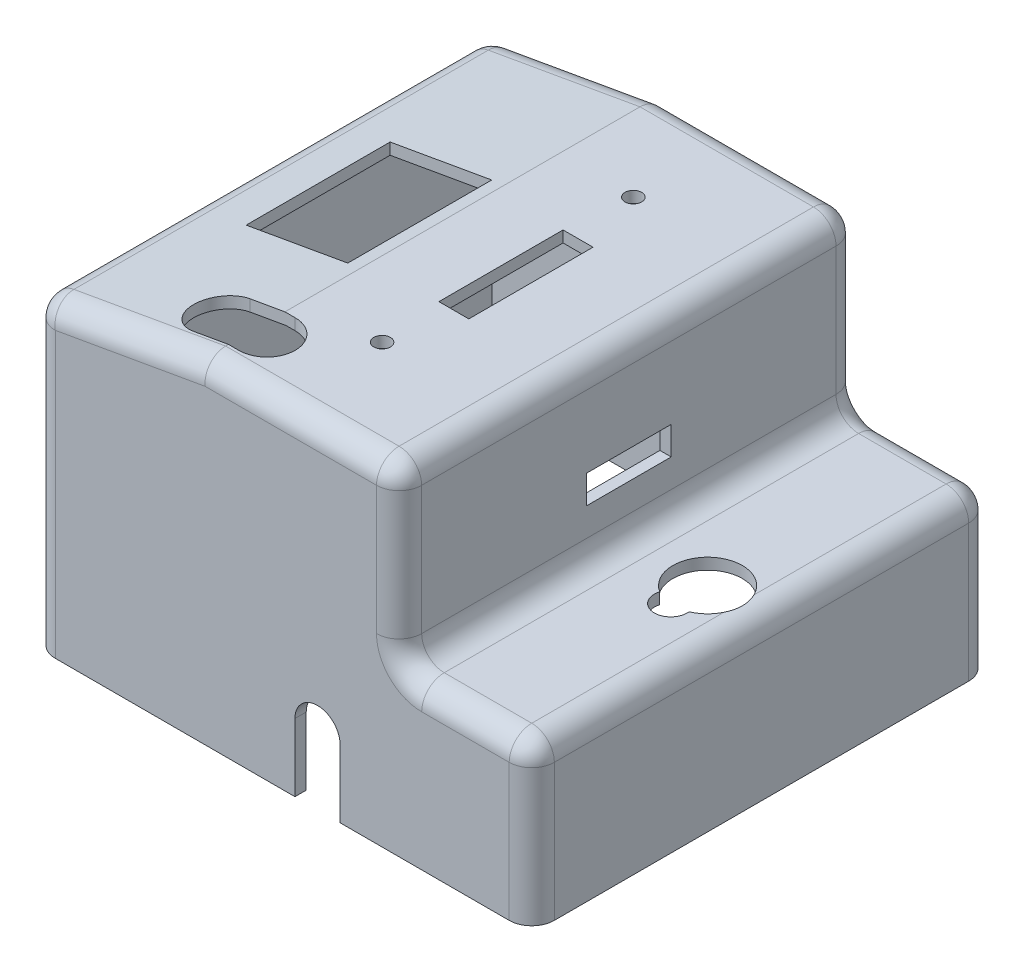
from build123d import *

# Parameters (mm, degrees)
BOSS_EXTRUDE1_DEPTH      = 38.7
BOSS_EXTRUDE1_DEPTH_BACK = 38.7
CHAMFER1_SIZE            = 5
CHAMFER1_SIZE2           = 28.356409098
SHELL1_T                 = 2
FILLET2_R                = 4
BOSS_EXTRUDE2_START      = -1.5
SKETCH2_W                = 6
SKETCH2_H                = 2.5
SKETCH2_H_2              = 6
SKETCH2_R                = 1.45
BOSS_EXTRUDE2_DEPTH      = 4
FILLET3_R                = 2
CUT_EXTRUDE1_REACH       = 69.496
SKETCH3_R                = 6.15
SKETCH3_R_2              = 2.9
BOSS_EXTRUDE3_START      = -1.5
SKETCH4_W                = 5
SKETCH4_H                = 20
BOSS_EXTRUDE3_DEPTH      = 2
FILLET4_R                = 2
CUT_EXTRUDE2_REACH       = 98.693
SKETCH5_W                = 15
SKETCH5_H                = 5
CUT_EXTRUDE3_DEPTH       = 110.820763104
CUT_EXTRUDE4_REACH       = 97
SKETCH7_W                = 18
SKETCH7_H                = 25.5
CUT_EXTRUDE5_REACH       = 86.209
CUT_EXTRUDE6_REACH       = 111.821
SKETCH10_W               = 13
SKETCH10_H               = 8
FILLET5_R                = 2
SKETCH11_W               = 5.3
SKETCH11_H               = 22
CUT_EXTRUDE7_DEPTH       = 85.208847569
SKETCH12_R               = 1.475
CUT_EXTRUDE8_DEPTH       = 85.208847569


with BuildPart() as part:
    # Sketch1 → Boss-Extrude1 (new, two sides: drawn at the far end of the back side and taken through both)
    with BuildSketch(Plane.XY.offset(-BOSS_EXTRUDE1_DEPTH_BACK)):
        Polygon((-42.2, 0), (42.2, 0), (42.2, 26.25), (18.7, 26.25), (18.7, 57), (-42.2, 57), align=None)
    extrude(amount=BOSS_EXTRUDE1_DEPTH + BOSS_EXTRUDE1_DEPTH_BACK)

    # Chamfer1
    chamfer1_edges = [part.edges().sort_by_distance(p)[0] for p in [
        (-42.2, 57, 0),
    ]]
    chamfer1_side = [part.faces().sort_by_distance(p)[0] for p in [
        (-42.2, 28.5, 0),
    ]]
    chamfer(chamfer1_edges, length=CHAMFER1_SIZE, length2=CHAMFER1_SIZE2, reference=chamfer1_side[0])

    # Shell1
    shell1_openings = [part.faces().sort_by_distance(p)[0] for p in [
        (0, 0, 0),
    ]]
    offset(amount=SHELL1_T, openings=shell1_openings, kind=Kind.INTERSECTION)

    # Fillet2
    # the kernel refuses this fillet: 4 mm, written as the material it adds along each edge
    with BuildSketch(Plane(origin=(20.7, 28.25, -40.7), x_dir=(0, 1, 0), z_dir=(0, 0, 1))) as fillet2_piece_1:
        with BuildLine():
            CenterArc((FILLET2_R, -FILLET2_R), FILLET2_R, 90, 90)
            Line((0, -FILLET2_R), (0, 0))
            Line((0, 0), (FILLET2_R, 0))
        make_face()
    extrude(amount=81.4)
    # the kernel refuses this fillet: 4 mm, written as the material it takes off along each edge
    with BuildSketch(Plane(origin=(-40.2, 50.321800738, 36.7), x_dir=(-0.1736481776669273, 0.9848077530122087, 0), z_dir=(0, 0, 1))) as fillet2_2_piece_1_section:
        Polygon((0, 0), (FILLET2_R, 0), (FILLET2_R, FILLET2_R * 0.839099631177), (FILLET2_R * 0.173648177667, FILLET2_R * 0.984807753012), align=None)
    fillet2_2_piece_1 = extrude(amount=FILLET2_R, mode=Mode.PRIVATE)
    fillet2_2_piece_1 = fillet2_2_piece_1 - Plane(origin=(-40.2, 50.321800738, 36.7), x_dir=(0.766044443118977, -0.6427876096865405, 0), z_dir=(0, 0, 1)) * Sphere(FILLET2_R, mode=Mode.PRIVATE)
    add(fillet2_2_piece_1, mode=Mode.SUBTRACT)
    with BuildSketch(Plane(origin=(-40.2, 50.321800738, -36.7), x_dir=(-0.1736481776669273, 0.9848077530122087, 0), z_dir=(0, 0, -1))) as fillet2_2_piece_2_section:
        Polygon((0, 0), (FILLET2_R, 0), (FILLET2_R, -FILLET2_R * 0.839099631177), (FILLET2_R * 0.173648177667, -FILLET2_R * 0.984807753012), align=None)
    fillet2_2_piece_2 = extrude(amount=FILLET2_R, mode=Mode.PRIVATE)
    fillet2_2_piece_2 = fillet2_2_piece_2 - Plane(origin=(-40.2, 50.321800738, -36.7), x_dir=(0.766044443118977, -0.6427876096865405, 0), z_dir=(0, 0, -1)) * Sphere(FILLET2_R, mode=Mode.PRIVATE)
    add(fillet2_2_piece_2, mode=Mode.SUBTRACT)
    with BuildSketch(Plane(origin=(20.7, 59, 50.7), x_dir=(0, -1, 0), z_dir=(0, 0, -1)), Plane(origin=(44.2, 28.25, 50.7), x_dir=(0, -1, 0), z_dir=(0, 0, -1))) as fillet2_2_piece_3:
        with BuildLine():
            CenterArc((FILLET2_R, FILLET2_R), FILLET2_R, 180, 90)
            Line((0, FILLET2_R), (0, 0))
            Line((0, 0), (FILLET2_R, 0))
        make_face()
    extrude(amount=101.4, mode=Mode.SUBTRACT)
    with BuildSketch(Plane(origin=(44.2, 38.25, -40.7), x_dir=(0, 0, 1), z_dir=(0, -1, 0))) as fillet2_2_piece_4:
        with BuildLine():
            CenterArc((FILLET2_R, FILLET2_R), FILLET2_R, 180, 90)
            Line((0, FILLET2_R), (0, 0))
            Line((0, 0), (FILLET2_R, 0))
        make_face()
    extrude(amount=48.25, mode=Mode.SUBTRACT)
    with BuildSketch(Plane(origin=(44.2, -10, 40.7), x_dir=(-1, 0, 0), z_dir=(0, 1, 0))) as fillet2_2_piece_5:
        with BuildLine():
            CenterArc((FILLET2_R, -FILLET2_R), FILLET2_R, 90, 90)
            Line((0, -FILLET2_R), (0, 0))
            Line((0, 0), (FILLET2_R, 0))
        make_face()
    extrude(amount=48.25, mode=Mode.SUBTRACT)
    with BuildSketch(Plane(origin=(30.7, 59, 40.7), x_dir=(0, -1, 0), z_dir=(-1, 0, 0)), Plane(origin=(-24.018568229, 59, -40.7), x_dir=(0, -1, 0), z_dir=(1, 0, 0))) as fillet2_2_piece_6:
        with BuildLine():
            CenterArc((FILLET2_R, -FILLET2_R), FILLET2_R, 90, 90)
            Line((0, -FILLET2_R), (0, 0))
            Line((0, 0), (FILLET2_R, 0))
        make_face()
    extrude(amount=54.718568229, mode=Mode.SUBTRACT)
    with BuildSketch(Plane(origin=(-44.2, 50.321800738, 40.7), x_dir=(0, 0, -1), z_dir=(0, -1, 0)), Plane(origin=(-44.2, -10, -40.7), x_dir=(0, 0, 1), z_dir=(0, 1, 0))) as fillet2_2_piece_7:
        with BuildLine():
            CenterArc((FILLET2_R, FILLET2_R), FILLET2_R, 180, 90)
            Line((0, FILLET2_R), (0, 0))
            Line((0, 0), (FILLET2_R, 0))
        make_face()
    extrude(amount=60.321800738, mode=Mode.SUBTRACT)
    with BuildSketch(Plane(origin=(-4.170490699, 60.736481777, 40.7), x_dir=(0.17364817766692728, -0.9848077530122086, 0), z_dir=(-0.9848077530122087, -0.1736481776669273, 0)), Plane(origin=(-40.894592711, 54.26103175, -40.7), x_dir=(0.1736481776669273, -0.9848077530122087, 1.77635683940025e-15), z_dir=(0.9848077530122087, 0.1736481776669273, 0))) as fillet2_2_piece_8:
        with BuildLine():
            CenterArc((FILLET2_R, -FILLET2_R), FILLET2_R, 90, 90)
            Line((0, -FILLET2_R), (0, 0))
            Line((0, 0), (FILLET2_R, 0))
        make_face()
    extrude(amount=37.29063048, mode=Mode.SUBTRACT)
    with BuildSketch(Plane(origin=(-44.2, 53.678199262, -36.7), x_dir=(0, -1, 0), z_dir=(0, 0, 1))) as fillet2_2_piece_9:
        with BuildLine():
            CenterArc((FILLET2_R * 0.839099631177, FILLET2_R), FILLET2_R, 190, 80)
            Line((-FILLET2_R * 0.145708121835, FILLET2_R * 0.826351822333), (0, 0))
            Line((0, 0), (FILLET2_R * 0.839099631177, 0))
        make_face()
    extrude(amount=73.4, mode=Mode.SUBTRACT)
    # the kernel refuses this fillet: 4 mm, written as the material it takes off along each edge
    with BuildSketch(Plane(origin=(16.7, 55, -36.7), x_dir=(1, 0, 0), z_dir=(0, 0, -1))) as fillet2_3_piece_1_section:
        Polygon((0, 0), (FILLET2_R, 0), (FILLET2_R, -FILLET2_R), (0, -FILLET2_R), align=None)
    fillet2_3_piece_1 = extrude(amount=FILLET2_R, mode=Mode.PRIVATE)
    fillet2_3_piece_1 = fillet2_3_piece_1 - Plane(origin=(16.7, 55, -36.7), x_dir=(-0.7071067811865475, -0.7071067811865476, 0), z_dir=(0, 0, -1)) * Sphere(FILLET2_R, mode=Mode.PRIVATE)
    add(fillet2_3_piece_1, mode=Mode.SUBTRACT)
    with BuildSketch(Plane(origin=(16.7, 55, 36.7), x_dir=(1, 0, 0), z_dir=(0, 0, 1))) as fillet2_3_piece_2_section:
        Polygon((0, 0), (FILLET2_R, 0), (FILLET2_R, FILLET2_R), (0, FILLET2_R), align=None)
    fillet2_3_piece_2 = extrude(amount=FILLET2_R, mode=Mode.PRIVATE)
    fillet2_3_piece_2 = fillet2_3_piece_2 - Plane(origin=(16.7, 55, 36.7), x_dir=(-0.7071067811865475, -0.7071067811865476, 0), z_dir=(0, 0, 1)) * Sphere(FILLET2_R, mode=Mode.PRIVATE)
    add(fillet2_3_piece_2, mode=Mode.SUBTRACT)
    with BuildSketch(Plane(origin=(40.2, 24.25, 36.7), x_dir=(0, 1, 0), z_dir=(0, 0, 1))) as fillet2_3_piece_3_section:
        Polygon((0, 0), (FILLET2_R, 0), (FILLET2_R, -FILLET2_R), (0, -FILLET2_R), align=None)
    fillet2_3_piece_3 = extrude(amount=FILLET2_R, mode=Mode.PRIVATE)
    fillet2_3_piece_3 = fillet2_3_piece_3 - Plane(origin=(40.2, 24.25, 36.7), x_dir=(-0.7071067811865475, -0.7071067811865476, 0), z_dir=(0, 0, 1)) * Sphere(FILLET2_R, mode=Mode.PRIVATE)
    add(fillet2_3_piece_3, mode=Mode.SUBTRACT)
    with BuildSketch(Plane(origin=(40.2, 24.25, -36.7), x_dir=(0, 1, 0), z_dir=(0, 0, -1))) as fillet2_3_piece_4_section:
        Polygon((0, 0), (FILLET2_R, 0), (FILLET2_R, FILLET2_R), (0, FILLET2_R), align=None)
    fillet2_3_piece_4 = extrude(amount=FILLET2_R, mode=Mode.PRIVATE)
    fillet2_3_piece_4 = fillet2_3_piece_4 - Plane(origin=(40.2, 24.25, -36.7), x_dir=(-0.7071067811865475, -0.7071067811865476, 0), z_dir=(0, 0, -1)) * Sphere(FILLET2_R, mode=Mode.PRIVATE)
    add(fillet2_3_piece_4, mode=Mode.SUBTRACT)
    with BuildSketch(Plane(origin=(24.7, 28.25, -40.7), x_dir=(0, -1, 0), z_dir=(1, 0, 0)), Plane(origin=(40.2, 28.25, 40.7), x_dir=(0, -1, 0), z_dir=(-1, 0, 0))) as fillet2_3_piece_5:
        with BuildLine():
            CenterArc((FILLET2_R, -FILLET2_R), FILLET2_R, 90, 90)
            Line((0, -FILLET2_R), (0, 0))
            Line((0, 0), (FILLET2_R, 0))
        make_face()
    extrude(amount=15.5, mode=Mode.SUBTRACT)
    with BuildSketch(Plane(origin=(20.7, 32.25, 40.7), x_dir=(-1, 0, 0), z_dir=(0, 1, 0)), Plane(origin=(20.7, 55, -40.7), x_dir=(-1, 0, 0), z_dir=(0, -1, 0))) as fillet2_3_piece_6:
        with BuildLine():
            CenterArc((FILLET2_R, -FILLET2_R), FILLET2_R, 90, 90)
            Line((0, -FILLET2_R), (0, 0))
            Line((0, 0), (FILLET2_R, 0))
        make_face()
    extrude(amount=22.75, mode=Mode.SUBTRACT)
    with BuildSketch(Plane(origin=(24.7, 32.25, -40.7), x_dir=(-1, 0, 0), z_dir=(0, 1, 0))) as fillet2_3_piece_7:
        with BuildLine():
            CenterArc((4 + FILLET2_R, FILLET2_R), FILLET2_R, 180, 90)
            Line((4, FILLET2_R), (4, 0))
            Line((4, 0), (4 + FILLET2_R, 0))
        make_face()
    revolve(axis=Axis((24.7, 32.25, -40.7), (0, 0, 1)), revolution_arc=90, mode=Mode.SUBTRACT)
    with BuildSketch(Plane(origin=(24.7, 32.25, 40.7), x_dir=(-1, 0, 0), z_dir=(0, 1, 0))) as fillet2_3_piece_8:
        with BuildLine():
            CenterArc((4 + FILLET2_R, -FILLET2_R), FILLET2_R, 90, 90)
            Line((4, -FILLET2_R), (4, 0))
            Line((4, 0), (4 + FILLET2_R, 0))
        make_face()
    revolve(axis=Axis((24.7, 32.25, 40.7), (0, 0, 1)), revolution_arc=90, mode=Mode.SUBTRACT)

    # Sketch2 → Boss-Extrude2 (add)
    # profile 1 of 2: a face of its own
    with BuildSketch(Plane.XZ.offset(BOSS_EXTRUDE2_START)):
        with Locations((39.2, -37.45)):
            Rectangle(SKETCH2_W, SKETCH2_H)
    # profile 2 of 2: a face of its own
    with BuildSketch(Plane.XZ.offset(BOSS_EXTRUDE2_START)):
        with Locations((39.2, -33.2)):
            Rectangle(SKETCH2_W, SKETCH2_H_2)
        with Locations(Location((39.2, -33.2, 0), (0, 0, 270))):
            Circle(SKETCH2_R, mode=Mode.SUBTRACT)
    boss_extrude2 = extrude(amount=-BOSS_EXTRUDE2_DEPTH)

    # Mirror1: Boss-Extrude2 across plane
    add(boss_extrude2.mirror(Plane.XY))

    # Fillet3
    fillet3_edges = [part.edges().sort_by_distance(p)[0] for p in [
        (42.2, 3.5, -30.2),
        (36.2, 3.5, -38.7),
        (36.2, 3.5, -30.2),
        (42.2, 3.5, 30.2),
        (36.2, 3.5, 30.2),
        (36.2, 3.5, 38.7),
    ]]
    fillet(fillet3_edges, radius=FILLET3_R)

    # Sketch3 → Cut-Extrude1 (cut, up to next)
    with BuildSketch(Plane(origin=(0, 28.25, 0), x_dir=(1, 0, 0), z_dir=(0, 1, 0)), mode=Mode.PRIVATE) as cut_extrude1_sk1:
        with Locations((34.65, 0)):
            Circle(SKETCH3_R)
    cut_extrude1_tool1 = extrude(cut_extrude1_sk1.sketch, amount=-CUT_EXTRUDE1_REACH, mode=Mode.PRIVATE) & part.part
    # Sketch3 → Cut-Extrude1 (cut, up to next)
    with BuildSketch(Plane(origin=(0, 28.25, 0), x_dir=(1, 0, 0), z_dir=(0, 1, 0)), mode=Mode.PRIVATE) as cut_extrude1_sk2:
        with Locations((34.151698836, -6.029444083)):
            Circle(SKETCH3_R_2)
    cut_extrude1_tool2 = extrude(cut_extrude1_sk2.sketch, amount=-CUT_EXTRUDE1_REACH, mode=Mode.PRIVATE) & part.part
    add(cut_extrude1_tool1.solids().sort_by_distance((34.65, 28.25, 0))[0], mode=Mode.SUBTRACT)
    add(cut_extrude1_tool2.solids().sort_by_distance((34.151699, 28.25, 6.029444))[0], mode=Mode.SUBTRACT)

    # Sketch4 → Boss-Extrude3 (add)
    with BuildSketch(Plane.XZ.offset(BOSS_EXTRUDE3_START)):
        with Locations((-39.7, 0)):
            Rectangle(SKETCH4_W, SKETCH4_H)
    extrude(amount=-BOSS_EXTRUDE3_DEPTH)

    # Fillet4
    fillet4_edges = [part.edges().sort_by_distance(p)[0] for p in [
        (-42.2, 3.5, 0),
        (-42.2, 2.5, -10),
        (-42.2, 2.5, 10),
    ]]
    fillet(fillet4_edges, radius=FILLET4_R)

    # Sketch5 → Cut-Extrude2 (cut, up to next)
    with BuildSketch(Plane(origin=(20.7, 0, 0), x_dir=(0, 0, -1), z_dir=(1, 0, 0)), mode=Mode.PRIVATE) as cut_extrude2_sk1:
        with Locations((0, 39.75)):
            Rectangle(SKETCH5_W, SKETCH5_H)
    cut_extrude2_tool1 = extrude(cut_extrude2_sk1.sketch, amount=-CUT_EXTRUDE2_REACH, mode=Mode.PRIVATE) & part.part
    add(cut_extrude2_tool1.solids().sort_by_distance((20.7, 39.75, 0))[0], mode=Mode.SUBTRACT)

    # Sketch6 → Cut-Extrude3 (cut, through all)
    with BuildSketch(Plane.XY.offset(40.7)):
        with BuildLine():
            Line((2.25, 0), (2.25, 12))
            ThreePointArc((2.25, 12), (6.25, 16), (10.25, 12))
            Line((10.25, 12), (10.25, 0))
            ThreePointArc((10.25, 0), (6.25, -4), (2.25, 0))
        make_face()
    extrude(amount=-CUT_EXTRUDE3_DEPTH, mode=Mode.SUBTRACT)

    # Cut-Extrude4: up to this plane
    cut_extrude4_end = Plane(origin=(-13.843590902, 57, -38.7), z_dir=(0.17364817766693122, -0.9848077530122079, 0))
    # Sketch7 → Cut-Extrude4 (cut, up to the surface)
    with BuildSketch(Plane(origin=(-18.150298314, 59, 0), x_dir=(1, 0, 0), z_dir=(0, 1, 0)), mode=Mode.PRIVATE) as cut_extrude4_sk1:
        with Locations((-7.191454162, 0)):
            Rectangle(SKETCH7_W, SKETCH7_H)
    cut_extrude4_tool1 = split(extrude(cut_extrude4_sk1.sketch, amount=-CUT_EXTRUDE4_REACH, mode=Mode.PRIVATE), bisect_by=cut_extrude4_end, keep=Keep.BOTH, mode=Mode.PRIVATE)
    add(cut_extrude4_tool1.solids().sort_by_distance((-25.341752, 59, 0))[0], mode=Mode.SUBTRACT)

    # Sketch8 → Cut-Extrude5 (cut, up to next)
    with BuildSketch(Plane(origin=(0, 59, 0), x_dir=(1, 0, 0), z_dir=(0, 1, 0)), mode=Mode.PRIVATE) as cut_extrude5_sk1:
        with BuildLine():
            Line((-12.2, -36.2), (-20.2, -36.2))
            ThreePointArc((-20.2, -36.2), (-25.2, -31.2), (-20.2, -26.2))
            Line((-20.2, -26.2), (-12.2, -26.2))
            ThreePointArc((-12.2, -26.2), (-7.2, -31.2), (-12.2, -36.2))
        make_face()
    cut_extrude5_tool1 = extrude(cut_extrude5_sk1.sketch, amount=-CUT_EXTRUDE5_REACH, mode=Mode.PRIVATE) & part.part
    add(cut_extrude5_tool1.solids().sort_by_distance((-16.2, 59, 31.2))[0], mode=Mode.SUBTRACT)

    # Sketch10 → Cut-Extrude6 (cut, up to next)
    with BuildSketch(Plane(origin=(0, 0, -40.7), x_dir=(-1, 0, 0), z_dir=(0, 0, -1)), mode=Mode.PRIVATE) as cut_extrude6_sk1:
        with Locations((18.2, 34.5)):
            Rectangle(SKETCH10_W, SKETCH10_H)
    cut_extrude6_tool1 = extrude(cut_extrude6_sk1.sketch, amount=-CUT_EXTRUDE6_REACH, mode=Mode.PRIVATE) & part.part
    add(cut_extrude6_tool1.solids().sort_by_distance((-18.2, 34.5, -40.7))[0], mode=Mode.SUBTRACT)

    # Fillet5
    fillet5_edges = [part.edges().sort_by_distance(p)[0] for p in [
        (-24.7, 38.5, -39.7),
        (-24.7, 30.5, -39.7),
        (-11.7, 30.5, -39.7),
        (-11.7, 38.5, -39.7),
    ]]
    fillet(fillet5_edges, radius=FILLET5_R)

    # Sketch11 → Cut-Extrude7 (cut, through all)
    with BuildSketch(Plane(origin=(0, 59, 0), x_dir=(1, 0, 0), z_dir=(0, 1, 0))):
        with Locations((0.7, 0)):
            Rectangle(SKETCH11_W, SKETCH11_H)
    extrude(amount=-CUT_EXTRUDE7_DEPTH, mode=Mode.SUBTRACT)

    # Sketch12 → Cut-Extrude8 (cut, through all)
    with BuildSketch(Plane(origin=(0, 59, 0), x_dir=(1, 0, 0), z_dir=(0, 1, 0))):
        with Locations(Location((-0.76, 22.25, 0), (0, 0, 180))):
            Circle(SKETCH12_R)
        with Locations(Location((-0.76, -22.25, 0), (0, 0, 180))):
            Circle(SKETCH12_R)
    extrude(amount=-CUT_EXTRUDE8_DEPTH, mode=Mode.SUBTRACT)


solid = part.part
